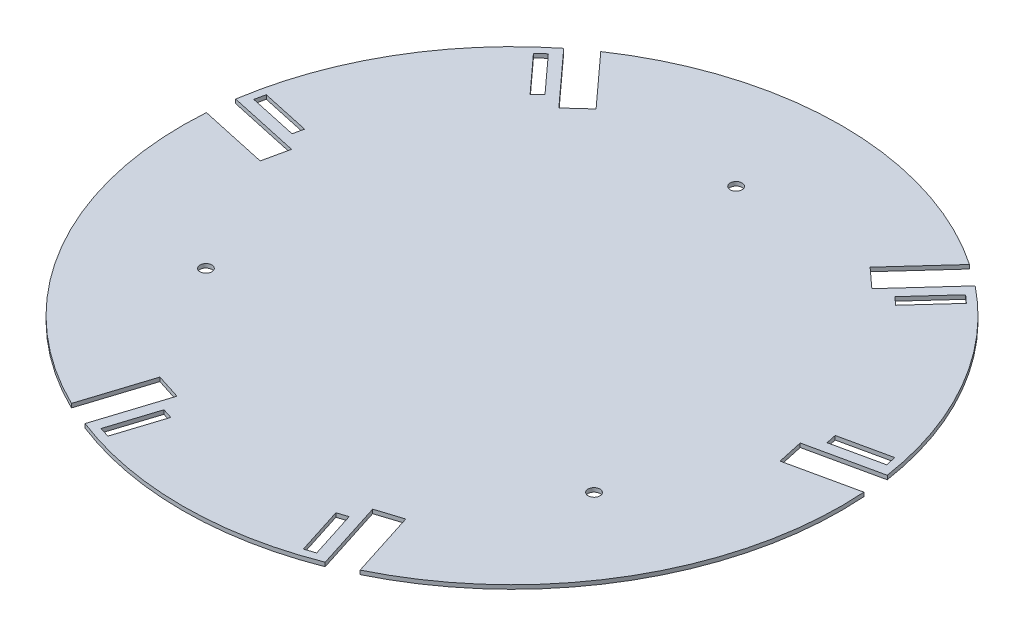
from build123d import *

# Parameters (mm, degrees)
SKETCH2_R           = 125
BOSS_EXTRUDE1_DEPTH = 1.5
SKETCH3_W           = 3
SKETCH3_H           = 19
CUT_EXTRUDE1_DEPTH  = 177.783059143
SKETCH4_R           = 2.25
CUT_EXTRUDE2_DEPTH  = 177.783059143
CUT_EXTRUDE5_DEPTH  = 177.783059143
CIRPATTERN2_COUNT   = 3


with BuildPart() as part:
    # Sketch2 → Boss-Extrude1 (new body)
    with BuildSketch(Plane(origin=(0, 0, 0), x_dir=(1, 0, 0), z_dir=(0, 1, 0))):
        Circle(SKETCH2_R)
    extrude(amount=BOSS_EXTRUDE1_DEPTH)

    # Sketch3 → Cut-Extrude1 (cut, through all)
    with BuildSketch(Plane(origin=(0, 1.5, 0), x_dir=(1, 0, 0), z_dir=(0, 1, 0))):
        with Locations((-268.691654721, -368.173324402)):
            Rectangle(SKETCH3_W, SKETCH3_H)
        Polygon((31.312, -98.125219266), (35.122688127, -96.909219266), (40.898688127, -115.009987868), (37.088, -116.225987868), align=None)
        Polygon((-37.088, -116.225987868), (-31.312, -98.125219266), (-35.122688127, -96.909219266), (-40.898688127, -115.009987868), align=None)
        Polygon((-82.110658074, 90.23214411), (-69.322932636, 76.179597076), (-66.364501682, 78.8717498), (-79.15222712, 92.924296834), align=None)
        Polygon((-100.634932636, 21.94562219), (-101.487189809, 18.037469466), (-120.050915246, 22.085691035), (-119.198658074, 25.993843759), align=None)
        Polygon((119.198658074, 25.993843759), (100.634932636, 21.94562219), (101.487189809, 18.037469466), (120.050915246, 22.085691035), align=None)
        Polygon((69.322932636, 76.179597076), (66.364501682, 78.8717498), (79.15222712, 92.924296834), (82.110658074, 90.23214411), align=None)
    extrude(amount=-CUT_EXTRUDE1_DEPTH, mode=Mode.SUBTRACT)

    # Sketch4 → Cut-Extrude2 (cut, through all)
    with BuildSketch(Plane(origin=(0, 1.5, 0), x_dir=(1, 0, 0), z_dir=(0, 1, 0))):
        with Locations((0, 85)):
            Circle(SKETCH4_R)
        with Locations((73.612159322, -42.5)):
            Circle(SKETCH4_R)
        with Locations((-73.612159322, -42.5)):
            Circle(SKETCH4_R)
    extrude(amount=-CUT_EXTRUDE2_DEPTH, mode=Mode.SUBTRACT)

    # Sketch6 → Cut-Extrude5 (cut, through all)
    with BuildSketch(Plane(origin=(0, 1.5, 0), x_dir=(1, 0, 0), z_dir=(0, 1, 0))):
        Polygon((-55.992533724, -149.153029157), (-65.519254041, -146.113029157), (-46.636096571, -86.937187076), (-37.109376254, -89.977187076), align=None)
        Polygon((65.519254041, -146.113029157), (46.636096571, -86.937187076), (37.109376254, -89.977187076), (55.992533724, -149.153029157), align=None)
    cut_extrude5 = extrude(amount=-CUT_EXTRUDE5_DEPTH, mode=Mode.SUBTRACT)

    # CirPattern2: Cut-Extrude5 ×3 about axis
    cirpattern2_axis = Axis((0, 1.5, 0), (0, 1, 0))
    for i in range(1, CIRPATTERN2_COUNT):
        add(cut_extrude5.rotate(cirpattern2_axis, i * 360 / CIRPATTERN2_COUNT), mode=Mode.SUBTRACT)


solid = part.part
